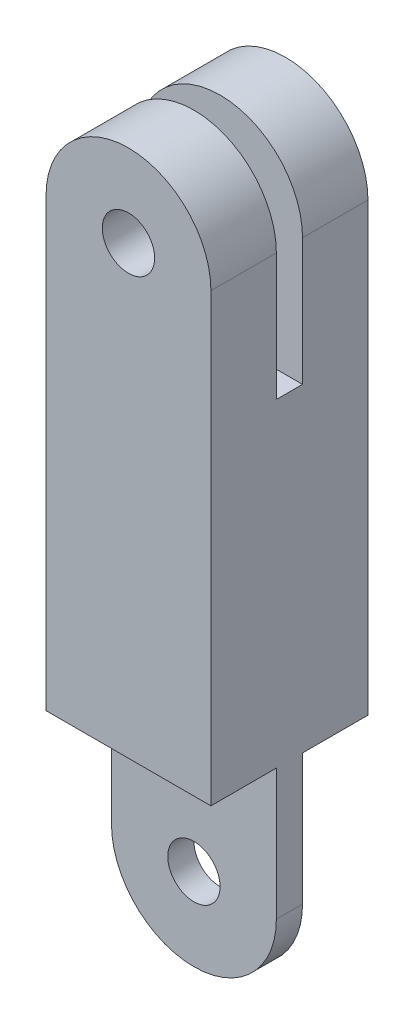
from build123d import *

# Parameters (mm, degrees)
SKETCH1_R                      = 3.175
BOSS_EXTRUDE1_DEPTH            = 9.525
CUT_EXTRUDE1_REACH             = 83.183
SKETCH2_W                      = 20
SKETCH2_H                      = 7.9375
CUT_EXTRUDE1_DIRECTION_2_DEPTH = 15.875
SKETCH3_W                      = 20
SKETCH3_H                      = 3.175
CUT_EXTRUDE2_DEPTH             = 25.4


with BuildPart() as part:
    # Sketch1 → Boss-Extrude1 (new, symmetric)
    with BuildSketch(Plane.XY):
        with BuildLine():
            Line((-10, 0), (-10, 70))
            ThreePointArc((-10, 70), (0, 80), (10, 70))
            Line((10, 70), (10, 0))
            ThreePointArc((10, 0), (0, -10), (-10, 0))
        make_face()
        with Locations((0, 70)):
            Circle(SKETCH1_R, mode=Mode.SUBTRACT)
        Circle(SKETCH1_R, mode=Mode.SUBTRACT)
    extrude(amount=BOSS_EXTRUDE1_DEPTH, both=True)

    # Sketch2 → Cut-Extrude1 (cut, up to next)
    with BuildSketch(Plane(origin=(0, 0, 0), x_dir=(1, 0, 0), z_dir=(0, 1, 0)), mode=Mode.PRIVATE) as cut_extrude1_sk1:
        with Locations((0, -5.55625)):
            Rectangle(SKETCH2_W, SKETCH2_H)
    cut_extrude1_tool1 = extrude(cut_extrude1_sk1.sketch, amount=-CUT_EXTRUDE1_REACH, mode=Mode.PRIVATE) & part.part
    # Sketch2 → Cut-Extrude1 (cut, up to next)
    with BuildSketch(Plane(origin=(0, 0, 0), x_dir=(1, 0, 0), z_dir=(0, 1, 0)), mode=Mode.PRIVATE) as cut_extrude1_sk2:
        with Locations((0, 5.55625)):
            Rectangle(SKETCH2_W, SKETCH2_H)
    cut_extrude1_tool2 = extrude(cut_extrude1_sk2.sketch, amount=-CUT_EXTRUDE1_REACH, mode=Mode.PRIVATE) & part.part
    add(cut_extrude1_tool1.solids().sort_by_distance((0, 0, 5.55625))[0], mode=Mode.SUBTRACT)
    add(cut_extrude1_tool2.solids().sort_by_distance((0, 0, -5.55625))[0], mode=Mode.SUBTRACT)

    # Sketch2 → Cut-Extrude1 direction 2 (cut)
    with BuildSketch(Plane(origin=(0, 0, 0), x_dir=(1, 0, 0), z_dir=(0, 1, 0))):
        with Locations((0, -5.55625)):
            Rectangle(SKETCH2_W, SKETCH2_H)
        with Locations((0, 5.55625)):
            Rectangle(SKETCH2_W, SKETCH2_H)
    extrude(amount=CUT_EXTRUDE1_DIRECTION_2_DEPTH, mode=Mode.SUBTRACT)

    # Sketch3 → Cut-Extrude2 (cut)
    with BuildSketch(Plane(origin=(0, 80, 0), x_dir=(-1, 0, 0), z_dir=(0, 1, 0))):
        Rectangle(SKETCH3_W, SKETCH3_H)
    extrude(amount=-CUT_EXTRUDE2_DEPTH, mode=Mode.SUBTRACT)


solid = part.part
